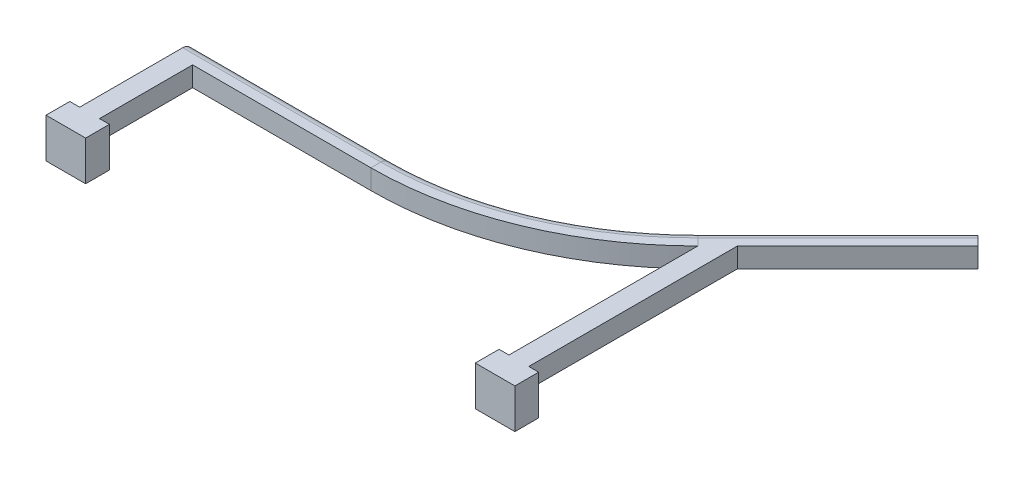
from build123d import *

# Parameters (mm, degrees)
SKETCH2_W           = 5
SKETCH2_H           = 5
FILLET1_R           = 2.5
SKETCH3_W           = 5
SKETCH3_H           = 29.5
BOSS_EXTRUDE1_DEPTH = 2.5
SKETCH4_W           = 10
SKETCH4_H           = 10
BOSS_EXTRUDE2_DEPTH = 6


with BuildPart() as part:
    # Sweep3: sweep along a path in Sketch1
    with BuildLine(Plane(origin=(0, 0, 0), x_dir=(1, 0, 0), z_dir=(0, 1, 0))) as sweep3_path:
        Line((0, 0), (50, 0))
        ThreePointArc((50, 0), (80.614674589, 6.089637399), (106.568542495, 23.431457505))
        Line((106.568542495, 23.431457505), (141.923881554, 58.786796564))
    # Sketch2 → Sweep3 (sweep)
    with BuildSketch(Plane(origin=(0, 0, 0), x_dir=(0, 0, -1), z_dir=(1, 0, 0))):
        Rectangle(SKETCH2_W, SKETCH2_H)
    sweep(path=sweep3_path.line)

    # Fillet1
    fillet1_edges = [part.edges().sort_by_distance(p)[0] for p in [
        (122.478445072, -2.5, -42.876893988),
        (79.657966008, -2.5, -8.39933623),
        (122.478445072, 2.5, -42.876893988),
        (79.657966008, 2.5, -8.39933623),
        (25, -2.5, -2.5),
        (25, 2.5, -2.5),
    ]]
    fillet(fillet1_edges, radius=FILLET1_R - 0.0001)  # a hair under: the kernel refuses the full size

    # Sketch3 → Boss-Extrude1 (add, symmetric)
    with BuildSketch(Plane(origin=(0, 0, 0), x_dir=(1, 0, 0), z_dir=(0, 1, 0))):
        with Locations((2.5, -17.25)):
            Rectangle(SKETCH3_W, SKETCH3_H)
        Polygon((108.336309448, 21.663690552), (113.336309448, 26.663690552), (113.336309448, -32), (108.336309448, -32), align=None)
    extrude(amount=BOSS_EXTRUDE1_DEPTH, both=True)

    # Sketch4 → Boss-Extrude2 (add)
    with BuildSketch(Plane.XY.offset(32)):
        with Locations((2.5, -2.5)):
            Rectangle(SKETCH4_W, SKETCH4_H)
        with Locations((110.836309448, -2.5)):
            Rectangle(SKETCH4_W, SKETCH4_H)
    extrude(amount=-BOSS_EXTRUDE2_DEPTH)


solid = part.part
